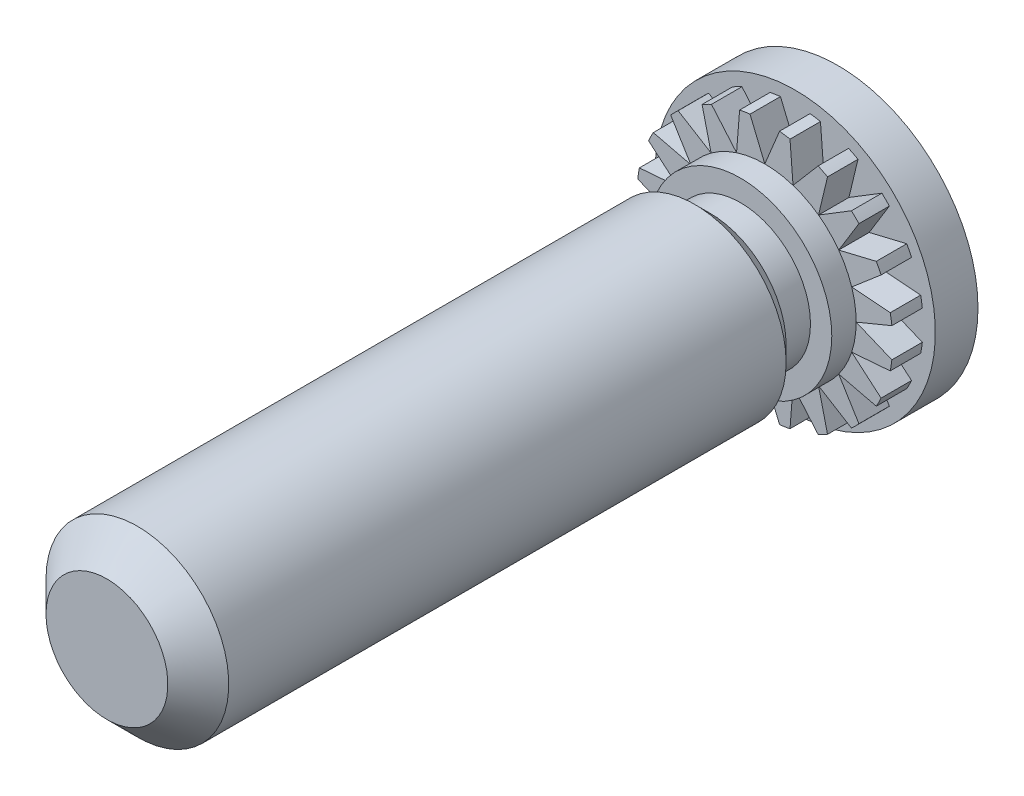
from build123d import *

# Parameters (mm, degrees)
SKETCH_1_R               = 2.3
EXTRUDE_1_DEPTH          = 1.2
SKETCH_2_R               = 1.5
EXTRUDE_2_DEPTH          = 1.5
CUT_EXTRUDE_1_DEPTH      = 0.5
PATTERN_CIRCULAR_1_COUNT = 20
SKETCH_4_W               = 0.35
SKETCH_4_H               = 0.5
SKETCH_6_W               = 9.3
SKETCH_6_H               = 1.5
CHAMFER_2_SIZE           = 0.5
CUT_EXTRUDE_START        = -0.5
SKETCH_7_R               = 2.3
SKETCH_7_R_2             = 2.1
CUT_EXTRUDE_2_DEPTH      = 0.5


with BuildPart() as part:
    # Эскиз1 → Вытянуть1 (new body)
    with BuildSketch(Plane.XY):
        Circle(SKETCH_1_R)
    extrude(amount=EXTRUDE_1_DEPTH)

    # Эскиз2 → Вытянуть2 (add)
    with BuildSketch(Plane.XY.offset(1.2)):
        Circle(SKETCH_2_R)
    extrude(amount=EXTRUDE_2_DEPTH)

    # Эскиз3 → Вырез-Вытянуть1 (cut)
    with BuildSketch(Plane.XY.offset(1.2)):
        Polygon((-0.33137085, 2.3), (0.33137085, 2.3), (0, 1.5), align=None)
    cut_extrude_1 = extrude(amount=-CUT_EXTRUDE_1_DEPTH, mode=Mode.SUBTRACT)

    # Круговой массив1: Вырез-Вытянуть1 ×20 about axis
    pattern_circular_1_axis = Axis((0, 0, 0), (0, 0, 1))
    for i in range(1, PATTERN_CIRCULAR_1_COUNT):
        add(cut_extrude_1.rotate(pattern_circular_1_axis, i * 360 / PATTERN_CIRCULAR_1_COUNT), mode=Mode.SUBTRACT)

    # Эскиз4 → Вырез-Повернуть1 (revolve, cut)
    with BuildSketch(Plane(origin=(0, 0, 0), x_dir=(1, 0, 0), z_dir=(0, 1, 0))):
        with Locations((1.325, -1.85)):
            Rectangle(SKETCH_4_W, SKETCH_4_H)
    revolve(axis=Axis((0, 0, 10.642619983), (0, 0, -1)), mode=Mode.SUBTRACT)

    # Эскиз6 → Повернуть1 (revolve)
    with BuildSketch(Plane(origin=(0, 0, 0), x_dir=(0, 0, -1), z_dir=(1, 0, 0)), mode=Mode.PRIVATE) as revolve_1_sk:
        with Locations((-7.35, -0.75)):
            Rectangle(SKETCH_6_W, SKETCH_6_H)
    revolve(revolve_1_sk.sketch.rotate(Axis((0, 0, 2.7), (0, 0, 1)), 278.047567557), axis=Axis((0, 0, 2.7), (0, 0, 1)))

    # Фаска2
    # the kernel refuses this chamfer: 0.5 mm, written as the material it takes off along each edge
    with BuildSketch(Plane(origin=(0, 0, 12), x_dir=(-0.9901521845161062, -0.1399951838385265, 0), z_dir=(-0.1399951838385265, 0.9901521845161062, 0))) as chamfer_2_piece_1:
        Polygon((1.5, -CHAMFER_2_SIZE), (1.5 - CHAMFER_2_SIZE, 0), (1.5, 0), align=None)
    revolve(axis=Axis((0, 0, 12), (0, 0, 1)), mode=Mode.SUBTRACT)

    # Эскиз7 → Вырез-Вытянуть2 (cut)
    with BuildSketch(Plane.XY.offset(1.2).offset(CUT_EXTRUDE_START)):
        with Locations(Location((0, 0, 0), (0, 0, 180))):
            Circle(SKETCH_7_R)
        Circle(SKETCH_7_R_2, mode=Mode.SUBTRACT)
    extrude(amount=CUT_EXTRUDE_2_DEPTH, mode=Mode.SUBTRACT)

    # Фаска3
    # the kernel refuses this chamfer: 0.25 mm, written as the material it takes off along each edge
    with BuildSketch(Plane(origin=(0, 0, 2.1), x_dir=(1, 0, 0), z_dir=(0, 1, 0))) as chamfer_3_piece_1:
        with BuildLine():
            Line((1.242928932, 0.007071068), (1.507071068, -0.257071068))
            Line((1.507071068, -0.257071068), (1.512071068, -0.257071068))
            ThreePointArc((1.512071068, -0.257071068), (1.505, -0.128535534), (1.505, 0))
            Line((1.505, 0), (1.5, 0.005))
            ThreePointArc((1.5, 0.005), (1.371464466, 0.005), (1.242928932, 0.012071068))
            Line((1.242928932, 0.012071068), (1.242928932, 0.007071068))
        make_face()
    revolve(axis=Axis((0, 0, 2.1), (0, 0, -1)), mode=Mode.SUBTRACT)


solid = part.part
